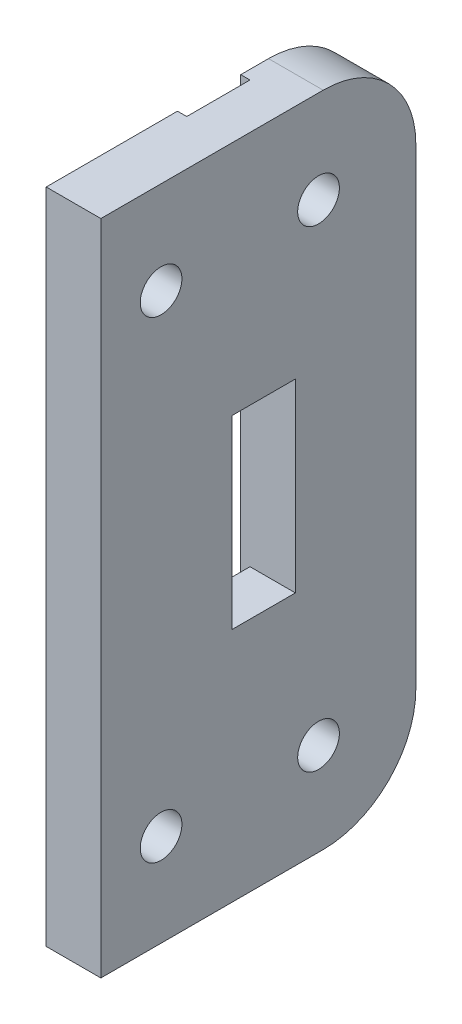
from build123d import *

# Parameters (mm, degrees)
SKETCH1_W           = 5.9
SKETCH1_H           = 34
BOSS_EXTRUDE1_DEPTH = 71
CUT_EXTRUDE2_REACH  = 81.734
SKETCH3_W           = 1
SKETCH3_H           = 6.827839233
FILLET1_R           = 10
CUT_EXTRUDE3_REACH  = 81.734
SKETCH4_R           = 2.25
CUT_EXTRUDE4_REACH  = 81.734
SKETCH5_W           = 6.827839233
SKETCH5_H           = 20


with BuildPart() as part:
    # Sketch1 → Boss-Extrude1 (new body)
    with BuildSketch(Plane(origin=(0, 0, 0), x_dir=(1, 0, 0), z_dir=(0, 1, 0))):
        with Locations((2.95, 18.8)):
            Rectangle(SKETCH1_W, SKETCH1_H)
    extrude(amount=BOSS_EXTRUDE1_DEPTH)

    # Sketch3 → Cut-Extrude2 (cut, up to next)
    with BuildSketch(Plane.XZ, mode=Mode.PRIVATE) as cut_extrude2_sk1:
        with Locations((0.5, -19.386080384)):
            Rectangle(SKETCH3_W, SKETCH3_H)
    cut_extrude2_tool1 = extrude(cut_extrude2_sk1.sketch, amount=-CUT_EXTRUDE2_REACH, mode=Mode.PRIVATE) & part.part
    add(cut_extrude2_tool1.solids().sort_by_distance((0.5, 0, -19.38608))[0], mode=Mode.SUBTRACT)

    # Fillet1
    fillet1_edges = [part.edges().sort_by_distance(p)[0] for p in [
        (2.95, 0, -35.8),
        (2.95, 71, -35.8),
    ]]
    fillet(fillet1_edges, radius=FILLET1_R)

    # Sketch4 → Cut-Extrude3 (cut, up to next)
    with BuildSketch(Plane(origin=(5.9, 0, 0), x_dir=(0, 0, -1), z_dir=(1, 0, 0)), mode=Mode.PRIVATE) as cut_extrude3_sk1:
        with Locations((25.3, 10)):
            Circle(SKETCH4_R)
    cut_extrude3_tool1 = extrude(cut_extrude3_sk1.sketch, amount=-CUT_EXTRUDE3_REACH, mode=Mode.PRIVATE) & part.part
    # Sketch4 → Cut-Extrude3 (cut, up to next)
    with BuildSketch(Plane(origin=(5.9, 0, 0), x_dir=(0, 0, -1), z_dir=(1, 0, 0)), mode=Mode.PRIVATE) as cut_extrude3_sk2:
        with Locations((8.3, 10)):
            Circle(SKETCH4_R)
    cut_extrude3_tool2 = extrude(cut_extrude3_sk2.sketch, amount=-CUT_EXTRUDE3_REACH, mode=Mode.PRIVATE) & part.part
    # Sketch4 → Cut-Extrude3 (cut, up to next)
    with BuildSketch(Plane(origin=(5.9, 0, 0), x_dir=(0, 0, -1), z_dir=(1, 0, 0)), mode=Mode.PRIVATE) as cut_extrude3_sk3:
        with Locations((8.3, 61)):
            Circle(SKETCH4_R)
    cut_extrude3_tool3 = extrude(cut_extrude3_sk3.sketch, amount=-CUT_EXTRUDE3_REACH, mode=Mode.PRIVATE) & part.part
    # Sketch4 → Cut-Extrude3 (cut, up to next)
    with BuildSketch(Plane(origin=(5.9, 0, 0), x_dir=(0, 0, -1), z_dir=(1, 0, 0)), mode=Mode.PRIVATE) as cut_extrude3_sk4:
        with Locations((25.3, 61)):
            Circle(SKETCH4_R)
    cut_extrude3_tool4 = extrude(cut_extrude3_sk4.sketch, amount=-CUT_EXTRUDE3_REACH, mode=Mode.PRIVATE) & part.part
    add(cut_extrude3_tool1.solids().sort_by_distance((5.9, 10, -25.3))[0], mode=Mode.SUBTRACT)
    add(cut_extrude3_tool2.solids().sort_by_distance((5.9, 10, -8.3))[0], mode=Mode.SUBTRACT)
    add(cut_extrude3_tool3.solids().sort_by_distance((5.9, 61, -8.3))[0], mode=Mode.SUBTRACT)
    add(cut_extrude3_tool4.solids().sort_by_distance((5.9, 61, -25.3))[0], mode=Mode.SUBTRACT)

    # Sketch5 → Cut-Extrude4 (cut, up to next)
    with BuildSketch(Plane(origin=(5.9, 0, 0), x_dir=(0, 0, -1), z_dir=(1, 0, 0)), mode=Mode.PRIVATE) as cut_extrude4_sk1:
        with Locations((19.386080384, 35.5)):
            Rectangle(SKETCH5_W, SKETCH5_H)
    cut_extrude4_tool1 = extrude(cut_extrude4_sk1.sketch, amount=-CUT_EXTRUDE4_REACH, mode=Mode.PRIVATE) & part.part
    add(cut_extrude4_tool1.solids().sort_by_distance((5.9, 35.5, -19.38608))[0], mode=Mode.SUBTRACT)


solid = part.part
